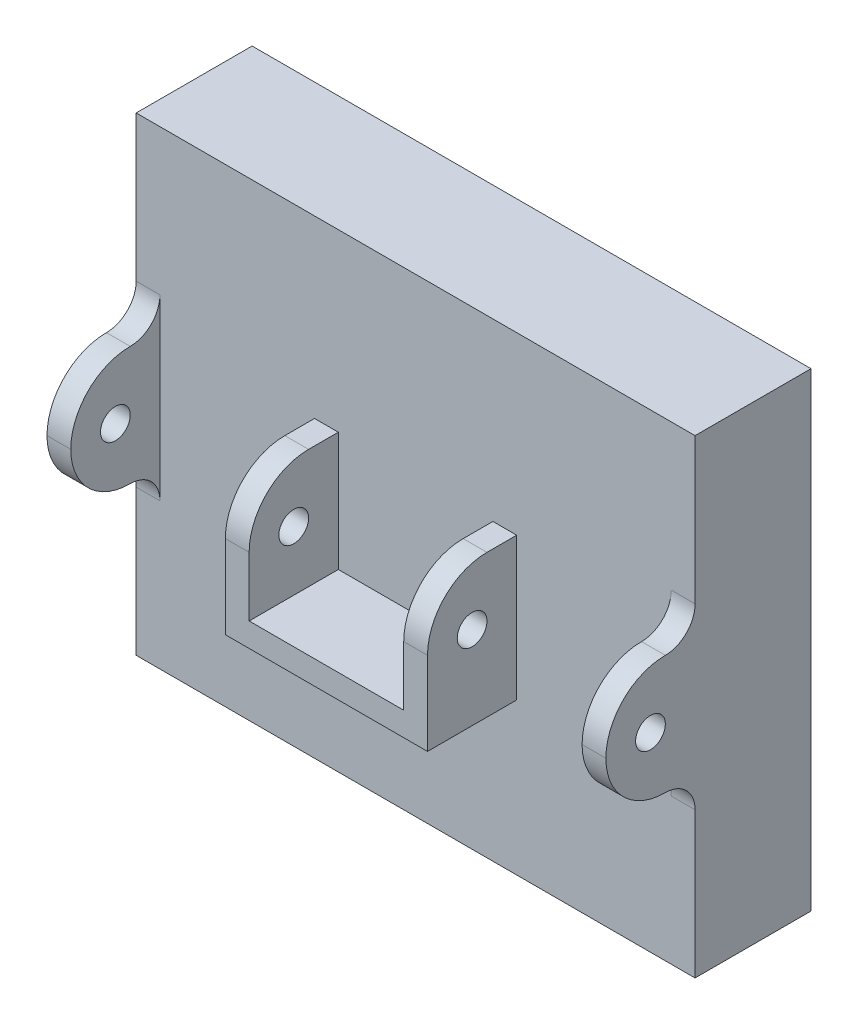
from build123d import *

# Parameters (mm, degrees)
SKIZZE1_W                       = 188
SKIZZE1_H                       = 158
AUFSATZ_LINEAR_AUSTRAGEN1_DEPTH = 39
SKIZZE2_W                       = 180
SKIZZE2_H                       = 150
SCHNITT_LINEAR_AUSTRAGEN1_DEPTH = 35
SKIZZE3_W                       = 8
SKIZZE3_H                       = 40
AUFSATZ_LINEAR_AUSTRAGEN2_DEPTH = 30
VERRUNDUNG1_R                   = 20
SKIZZE4_R                       = 5
SCHNITT_LINEAR_AUSTRAGEN2_DEPTH = 208
VERRUNDUNG2_R                   = 10


with BuildPart() as part:
    # Skizze1 → Aufsatz-Linear austragen1 (new body)
    with BuildSketch(Plane.XY):
        Rectangle(SKIZZE1_W, SKIZZE1_H)
    extrude(amount=AUFSATZ_LINEAR_AUSTRAGEN1_DEPTH)

    # Skizze2 → Schnitt-Linear austragen1 (cut)
    with BuildSketch(Plane.XY):
        Rectangle(SKIZZE2_W, SKIZZE2_H)
    extrude(amount=SCHNITT_LINEAR_AUSTRAGEN1_DEPTH, mode=Mode.SUBTRACT)

    # Skizze3 → Aufsatz-Linear austragen2 (add)
    with BuildSketch(Plane.XY.offset(39)):
        with Locations((-90, 0)):
            Rectangle(SKIZZE3_W, SKIZZE3_H)
        Polygon((-34, 20), (-26, 20), (-26, -20), (26, -20), (26, 20), (34, 20), (34, -20), (34, -28), (-34, -28), (-34, -20), align=None)
        with Locations((90, 0)):
            Rectangle(SKIZZE3_W, SKIZZE3_H)
    extrude(amount=AUFSATZ_LINEAR_AUSTRAGEN2_DEPTH)

    # Verrundung1
    verrundung1_edges = [part.edges().sort_by_distance(p)[0] for p in [
        (-90, -20, 69),
        (-90, 20, 69),
        (30, 20, 69),
        (-30, 20, 69),
        (90, -20, 69),
        (90, 20, 69),
    ]]
    fillet(verrundung1_edges, radius=VERRUNDUNG1_R - 0.0001)  # a hair under: the kernel refuses the full size

    # Skizze4 → Schnitt-Linear austragen2 (cut)
    with BuildSketch(Plane.ZY.offset(94)):
        with Locations((54, 0)):
            Circle(SKIZZE4_R)
    extrude(amount=-SCHNITT_LINEAR_AUSTRAGEN2_DEPTH, mode=Mode.SUBTRACT)

    # Verrundung2
    verrundung2_edges = [part.edges().sort_by_distance(p)[0] for p in [
        (-90, 20, 39),
        (-90, -20, 39),
        (90, 20, 39),
        (90, -20, 39),
    ]]
    fillet(verrundung2_edges, radius=VERRUNDUNG2_R)


solid = part.part
